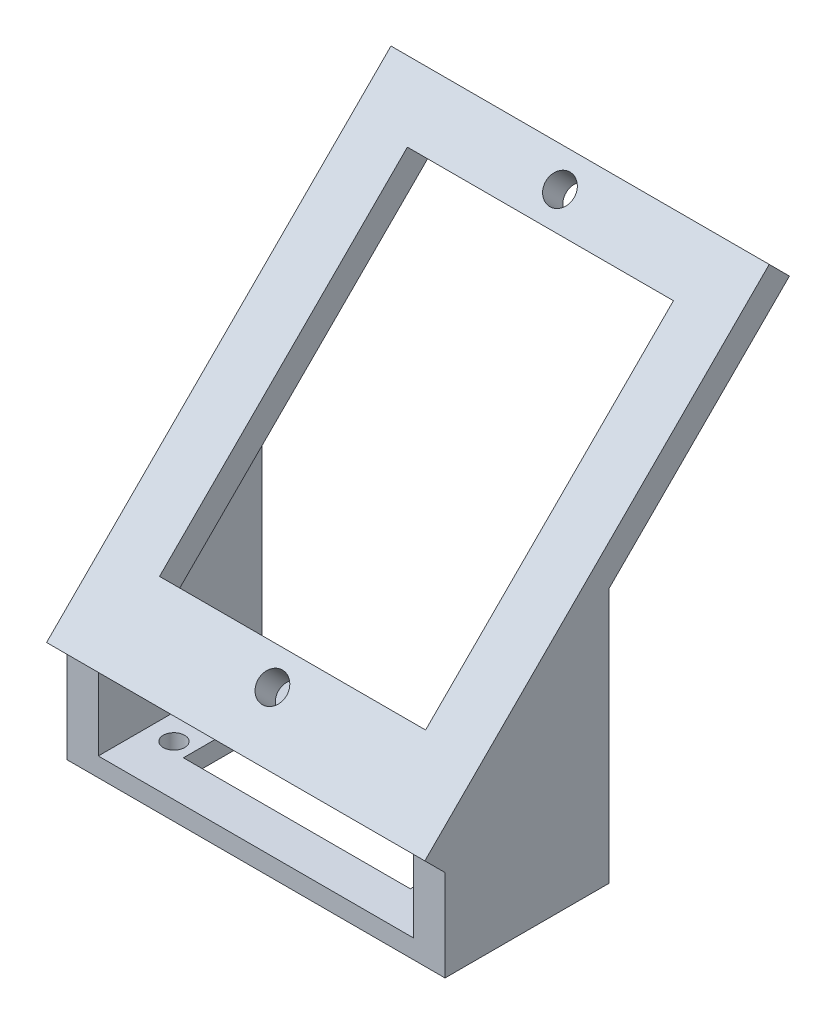
from build123d import *

# Parameters (mm, degrees)
SKETCH_1_W                  = 60
SKETCH_1_H                  = 26
SKETCH_1_R                  = 1.7
EXTRUDE_3_DEPTH             = 12
SKETCH_10_W                 = 5
SKETCH_10_H                 = 4
EXTRUDE_4_DEPTH             = 60
EXTRUDE_START               = -60
EXTRUDE_6_DEPTH             = 60
CUT_EXTRUDE_6_REACH         = 219.643
SKETCH_20_W                 = 5
SKETCH_20_H                 = 4
CUT_EXTRUDE_7_REACH         = 219.643
SKETCH_21_W                 = 5
SKETCH_21_H                 = 4
CUT_EXTRUDE_8_REACH         = 219.643
SKETCH_22_W                 = 5
SKETCH_22_H                 = 4
SKETCH_23_R                 = 2.25
CUT_EXTRUDE_9_DEPTH         = 10
EXTRUDE_8_REACH             = 218.77
SKETCH_24_W                 = 5
SKETCH_24_H                 = 18
EXTRUDE_8_DIRECTION_2_REACH = 218.77
EXTRUDE_START_2             = -146.796406348
EXTRUDE_9_DEPTH             = 5
SKETCH_28_W                 = 60
SKETCH_28_H                 = 9
CUT_EXTRUDE_10_DEPTH        = 26


with BuildPart() as part:
    # 草图1 → 凸台-拉伸3 (new body)
    with BuildSketch(Plane(origin=(0, 0, 0), x_dir=(1, 0, 0), z_dir=(0, 1, 0))):
        with Locations((-171.796406348, -22.041144508)):
            Rectangle(SKETCH_1_W, SKETCH_1_H)
        with Locations(Location((-150.796406348, -17.041144508, 0), (0, 0, 270))):
            Circle(SKETCH_1_R, mode=Mode.SUBTRACT)
        with Locations(Location((-150.796406348, -27.041144508, 0), (0, 0, 270))):
            Circle(SKETCH_1_R, mode=Mode.SUBTRACT)
        with Locations(Location((-192.796406348, -27.041144508, 0), (0, 0, 270))):
            Circle(SKETCH_1_R, mode=Mode.SUBTRACT)
        with Locations(Location((-198.796406348, -27.041144508, 0), (0, 0, 270))):
            Circle(SKETCH_1_R, mode=Mode.SUBTRACT)
        with Locations(Location((-198.796406348, -17.041144508, 0), (0, 0, 270))):
            Circle(SKETCH_1_R, mode=Mode.SUBTRACT)
        with Locations(Location((-192.796406348, -17.041144508, 0), (0, 0, 270))):
            Circle(SKETCH_1_R, mode=Mode.SUBTRACT)
        with Locations(Location((-144.796406348, -27.041144508, 0), (0, 0, 270))):
            Circle(SKETCH_1_R, mode=Mode.SUBTRACT)
        with Locations(Location((-144.796406348, -17.041144508, 0), (0, 0, 270))):
            Circle(SKETCH_1_R, mode=Mode.SUBTRACT)
        Polygon((-154.244576261, -28.541144508), (-153.796406348, -28.541144508), (-153.796406348, -27.585746487), (-153.796406348, -16.496542529), (-153.796406348, -15.541144508), (-154.244576261, -15.541144508), (-160.170728493, -15.541144508), (-183.422084204, -15.541144508), (-189.348236436, -15.541144508), (-189.796406348, -15.541144508), (-189.796406348, -16.496542529), (-189.796406348, -27.585746487), (-189.796406348, -28.541144508), (-189.348236436, -28.541144508), (-183.422084204, -28.541144508), (-160.170728493, -28.541144508), align=None, mode=Mode.SUBTRACT)
    extrude(amount=EXTRUDE_3_DEPTH)

    # 草图10 → 凸台-拉伸4 (add)
    with BuildSketch(Plane(origin=(0, 12, 0), x_dir=(1, 0, 0), z_dir=(0, 1, 0))):
        with Locations((-144.296406348, -11.041144508)):
            Rectangle(SKETCH_10_W, SKETCH_10_H)
        with Locations((-199.296406348, -11.041144508)):
            Rectangle(SKETCH_10_W, SKETCH_10_H)
        with Locations((-199.296406348, -33.041144508)):
            Rectangle(SKETCH_10_W, SKETCH_10_H)
        with Locations((-144.296406348, -33.041144508)):
            Rectangle(SKETCH_10_W, SKETCH_10_H)
    extrude(amount=EXTRUDE_4_DEPTH)

    # 草图16 → 凸台-拉伸6 (add)
    with BuildSketch(Plane.ZY.offset(201.796406348).offset(EXTRUDE_START)):
        Polygon((35.041144508, 23.487382081), (-19.586360532, 78.114887122), (-16.383147731, 81.318099924), (38.24435731, 26.690594883), align=None)
    extrude(amount=EXTRUDE_6_DEPTH)

    # 切除-拉伸6: up to this plane
    cut_extrude_6_end = Plane(origin=(-60.011420854, 81.318099924, -16.383147731), z_dir=(0, 0.707106781186548, 0.7071067811865472))
    # 草图20 → 切除-拉伸6 (cut, up to the surface)
    with BuildSketch(Plane(origin=(0, 72, 0), x_dir=(1, 0, 0), z_dir=(0, 1, 0)), mode=Mode.PRIVATE) as cut_extrude_6_sk1:
        with Locations((-199.296406348, -11.041144508)):
            Rectangle(SKETCH_20_W, SKETCH_20_H)
    cut_extrude_6_tool1 = split(extrude(cut_extrude_6_sk1.sketch, amount=-CUT_EXTRUDE_6_REACH, mode=Mode.PRIVATE), bisect_by=cut_extrude_6_end, keep=Keep.BOTH, mode=Mode.PRIVATE)
    add(cut_extrude_6_tool1.solids().sort_by_distance((-199.296406, 72, 11.041145))[0], mode=Mode.SUBTRACT)

    # 切除-拉伸7: up to this face of the body (flat: up to its plane)
    cut_extrude_7_end = Plane(part.part.faces().sort_by_distance((-171.967338534, 54.279900151, 10.655052042))[0])
    # 草图21 → 切除-拉伸7 (cut, up to the picked face)
    with BuildSketch(Plane(origin=(0, 72, 0), x_dir=(1, 0, 0), z_dir=(0, 1, 0)), mode=Mode.PRIVATE) as cut_extrude_7_sk1:
        with Locations((-199.296406348, -33.041144508)):
            Rectangle(SKETCH_21_W, SKETCH_21_H)
    cut_extrude_7_tool1 = split(extrude(cut_extrude_7_sk1.sketch, amount=-CUT_EXTRUDE_7_REACH, mode=Mode.PRIVATE), bisect_by=cut_extrude_7_end, keep=Keep.BOTH, mode=Mode.PRIVATE)
    add(cut_extrude_7_tool1.solids().sort_by(Axis((-199.296406, 72, 33.041145), (0, -1, 0)))[0], mode=Mode.SUBTRACT)

    # 切除-拉伸8: up to this face of the body (flat: up to its plane)
    cut_extrude_8_end = Plane(part.part.faces().sort_by_distance((-172.136158915, 54.141614108, 10.793338085))[0])
    # 草图22 → 切除-拉伸8 (cut, up to the picked face)
    with BuildSketch(Plane(origin=(0, 72, 0), x_dir=(1, 0, 0), z_dir=(0, 1, 0)), mode=Mode.PRIVATE) as cut_extrude_8_sk1:
        with Locations((-144.296406348, -11.041144508)):
            Rectangle(SKETCH_22_W, SKETCH_22_H)
    cut_extrude_8_tool1 = split(extrude(cut_extrude_8_sk1.sketch, amount=-CUT_EXTRUDE_8_REACH, mode=Mode.PRIVATE), bisect_by=cut_extrude_8_end, keep=Keep.BOTH, mode=Mode.PRIVATE)
    # 草图22 → 切除-拉伸8 (cut, up to the picked face)
    with BuildSketch(Plane(origin=(0, 72, 0), x_dir=(1, 0, 0), z_dir=(0, 1, 0)), mode=Mode.PRIVATE) as cut_extrude_8_sk2:
        with Locations((-144.296406348, -33.041144508)):
            Rectangle(SKETCH_22_W, SKETCH_22_H)
    cut_extrude_8_tool2 = split(extrude(cut_extrude_8_sk2.sketch, amount=-CUT_EXTRUDE_8_REACH, mode=Mode.PRIVATE), bisect_by=cut_extrude_8_end, keep=Keep.BOTH, mode=Mode.PRIVATE)
    add(cut_extrude_8_tool1.solids().sort_by(Axis((-144.296406, 72, 11.041145), (0, -1, 0)))[0], mode=Mode.SUBTRACT)
    add(cut_extrude_8_tool2.solids().sort_by(Axis((-144.296406, 72, 33.041145), (0, -1, 0)))[0], mode=Mode.SUBTRACT)

    # 草图23 → 切除-拉伸9 (cut)
    with BuildSketch(Plane(origin=(0, 32.467476097, 32.467476097), x_dir=(1, 0, 0), z_dir=(0, 0.7071067811865478, 0.7071067811865472))):
        Polygon((-150.696406348, 25.486333053), (-150.696406348, 4.585214747), (-192.896406348, 4.585214747), (-192.896406348, 25.486333053), (-192.896406348, 57.849143044), (-192.896406348, 60.185214747), (-150.696406348, 60.185214747), (-150.696406348, 57.849143044), align=None)
        with Locations(Location((-171.844403565, 64.635214747, 0), (0, 0, 270))):
            Circle(SKETCH_23_R)
        with Locations(Location((-171.844403565, 0.135214747, 0), (0, 0, 90))):
            Circle(SKETCH_23_R)
    extrude(amount=-CUT_EXTRUDE_9_DEPTH, mode=Mode.SUBTRACT)

    # 草图24 → 凸台-拉伸8 (add, up to next)
    with BuildSketch(Plane(origin=(0, 12, 0), x_dir=(1, 0, 0), z_dir=(0, 1, 0)), mode=Mode.PRIVATE) as extrude_8_sk1:
        with Locations((-199.296406348, -22.041144508)):
            Rectangle(SKETCH_24_W, SKETCH_24_H)
    extrude_8_tool1 = extrude(extrude_8_sk1.sketch, amount=EXTRUDE_8_REACH, mode=Mode.PRIVATE) - part.part
    add(extrude_8_tool1.solids().sort_by_distance((-199.296406, 12, 22.041145))[0])

    # 凸台-拉伸8 direction 2: up to this face of the body (flat: up to its plane)
    extrude_8_direction_2_end = Plane(part.part.faces().sort_by_distance((-142.450317657, 0, 22.041144508))[0])
    # 草图24 → 凸台-拉伸8 direction 2 (add, up to the picked face)
    with BuildSketch(Plane(origin=(0, 12, 0), x_dir=(1, 0, 0), z_dir=(0, 1, 0)), mode=Mode.PRIVATE) as extrude_8_direction_2_sk1:
        with Locations((-199.296406348, -22.041144508)):
            Rectangle(SKETCH_24_W, SKETCH_24_H)
    extrude_8_direction_2_tool1 = split(extrude(extrude_8_direction_2_sk1.sketch, amount=-EXTRUDE_8_DIRECTION_2_REACH, mode=Mode.PRIVATE), bisect_by=extrude_8_direction_2_end, keep=Keep.BOTH, mode=Mode.PRIVATE)
    add(extrude_8_direction_2_tool1.solids().sort_by(Axis((-199.296406, 12, 22.041145), (0, -1, 0)))[0])

    # 凸台-拉伸9: read off the stored shape, not the designer's step
    # 凸台-拉伸9 outline → 凸台-拉伸9 (add)
    with BuildSketch(Plane.YZ.offset(EXTRUDE_START_2)):
        Polygon((49.487382081, 9.041144508), (23.487382081, 35.041144508), (0, 35.041144508), (0, 9.041144508), align=None)
    extrude(amount=EXTRUDE_9_DEPTH)

    # 草图28 → 切除-拉伸10 (cut)
    with BuildSketch(Plane.XY.offset(35.041144508)):
        with Locations((-171.796406348, 4.5)):
            Rectangle(SKETCH_28_W, SKETCH_28_H)
    extrude(amount=-CUT_EXTRUDE_10_DEPTH, mode=Mode.SUBTRACT)


solid = part.part
